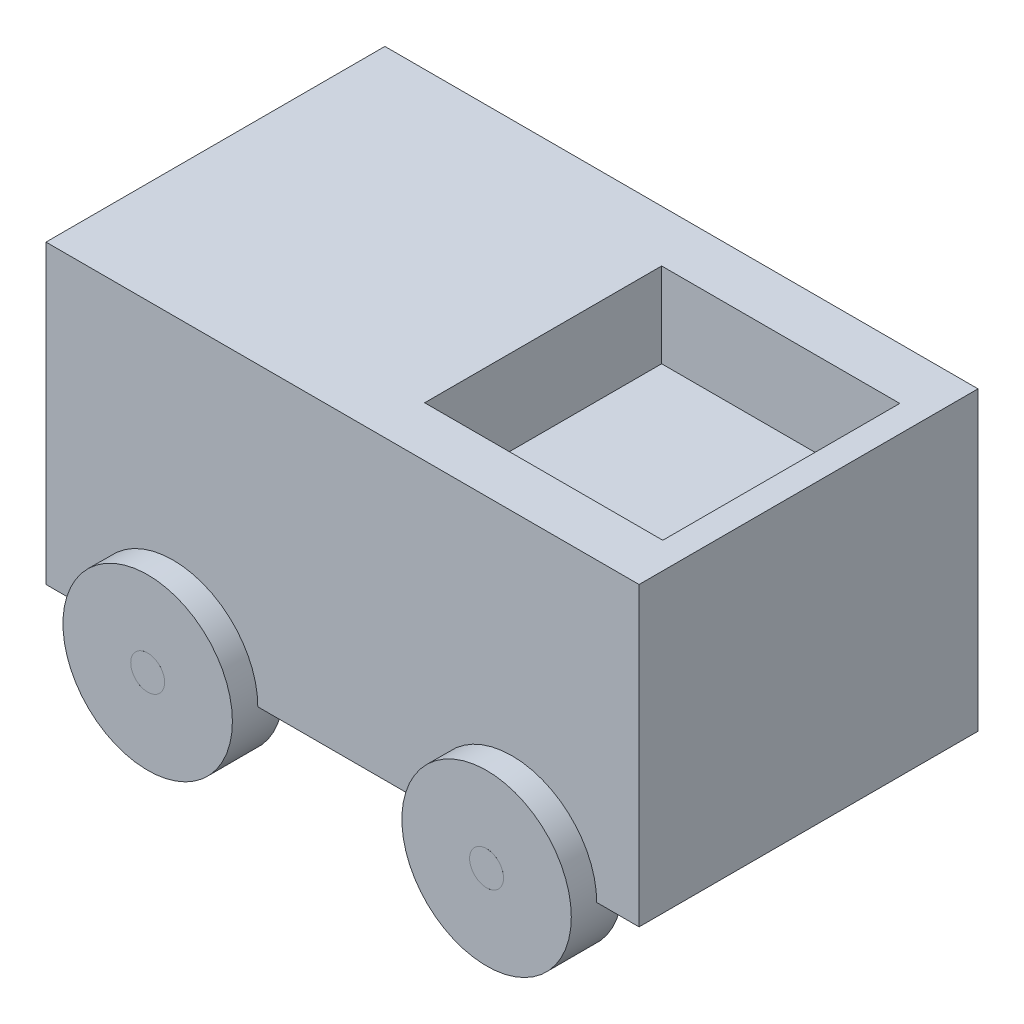
from build123d import *

# Parameters (mm, degrees)
SKETCH2_W                 = 70
SKETCH2_H                 = 35
BOSS_EXTRUDE2_DEPTH       = 40
SKETCH3_W                 = 28.105894453
SKETCH3_H                 = 27.971945797
CUT_EXTRUDE1_DEPTH        = 10
SKETCH4_R                 = 10
CUT_EXTRUDE2_DEPTH        = 3
CUT_EXTRUDE3_START        = -3
SKETCH5_R                 = 10
CUT_EXTRUDE3_DEPTH        = 3
BOSS_EXTRUDE3_DEPTH       = 3
BOSS_EXTRUDE3_DEPTH_BACK  = 3
SKETCH6_R                 = 10
SKETCH7_R                 = 10
BOSS_EXTRUDE5_DEPTH       = 6
SKETCH8_R                 = 2
CUT_EXTRUDE5_DEPTH        = 46
BOSS_EXTRUDE8_DEPTH       = 0.0001
BOSS_EXTRUDE8_DEPTH_BACK  = 46.0001
SKETCH9_R                 = 2
BOSS_EXTRUDE9_DEPTH       = 3
BOSS_EXTRUDE9_DEPTH_BACK  = 3
SKETCH10_R                = 10
BOSS_EXTRUDE10_DEPTH      = 3
BOSS_EXTRUDE10_DEPTH_BACK = 3
SKETCH11_R                = 10
SKETCH12_R                = 2
CUT_EXTRUDE6_DEPTH        = 46
BOSS_EXTRUDE11_DEPTH      = 0.001
BOSS_EXTRUDE11_DEPTH_BACK = 46.001
SKETCH13_R                = 2


with BuildPart() as part:
    # Sketch2 → Boss-Extrude2 (new body)
    with BuildSketch(Plane.XY):
        with Locations((-35, -17.5)):
            Rectangle(SKETCH2_W, SKETCH2_H)
    extrude(amount=BOSS_EXTRUDE2_DEPTH)

    # Sketch3 → Cut-Extrude1 (cut)
    with BuildSketch(Plane(origin=(0, 0, 0), x_dir=(1, 0, 0), z_dir=(0, 1, 0))):
        with Locations((-17.175677586, -20.094439992)):
            Rectangle(SKETCH3_W, SKETCH3_H)
    extrude(amount=-CUT_EXTRUDE1_DEPTH, mode=Mode.SUBTRACT)

    # Sketch4 → Cut-Extrude2 (cut)
    with BuildSketch(Plane.XY.offset(40)):
        with Locations((-15, -35)):
            Circle(SKETCH4_R)
        with Locations((-55, -35)):
            Circle(SKETCH4_R)
    extrude(amount=-CUT_EXTRUDE2_DEPTH, mode=Mode.SUBTRACT)

    # Sketch5 → Cut-Extrude3 (cut)
    with BuildSketch(Plane(origin=(0, 0, 0), x_dir=(-1, 0, 0), z_dir=(0, 0, -1)).offset(CUT_EXTRUDE3_START)):
        with Locations((15, -35)):
            Circle(SKETCH5_R)
        with Locations((55, -35)):
            Circle(SKETCH5_R)
    extrude(amount=CUT_EXTRUDE3_DEPTH, mode=Mode.SUBTRACT)

    # Sketch6 → Boss-Extrude3 (add, two sides: drawn at the far end of the back side and taken through both)
    with BuildSketch(Plane.XY.offset(40).offset(-BOSS_EXTRUDE3_DEPTH_BACK)):
        with Locations((-55, -35)):
            Circle(SKETCH6_R)
    extrude(amount=BOSS_EXTRUDE3_DEPTH + BOSS_EXTRUDE3_DEPTH_BACK)

    # Sketch7 → Boss-Extrude5 (add)
    with BuildSketch(Plane(origin=(0, 0, 3), x_dir=(-1, 0, 0), z_dir=(0, 0, -1))):
        with Locations((55, -35)):
            Circle(SKETCH7_R)
    extrude(amount=BOSS_EXTRUDE5_DEPTH)

    # Sketch8 → Cut-Extrude5 (cut)
    with BuildSketch(Plane(origin=(0, 0, -3), x_dir=(-1, 0, 0), z_dir=(0, 0, -1))):
        with Locations((55, -35)):
            Circle(SKETCH8_R)
    extrude(amount=-CUT_EXTRUDE5_DEPTH, mode=Mode.SUBTRACT)

    # Sketch9 → Boss-Extrude8 (add, two sides: drawn at the far end of the back side and taken through both)
    with BuildSketch(Plane(origin=(0, 0, -3), x_dir=(-1, 0, 0), z_dir=(0, 0, -1)).offset(-BOSS_EXTRUDE8_DEPTH_BACK)):
        with Locations((55, -35)):
            Circle(SKETCH9_R)
    extrude(amount=BOSS_EXTRUDE8_DEPTH + BOSS_EXTRUDE8_DEPTH_BACK)

    # Sketch10 → Boss-Extrude9 (add, two sides: drawn at the far end of the back side and taken through both)
    with BuildSketch(Plane.XY.offset(40).offset(-BOSS_EXTRUDE9_DEPTH_BACK)):
        with Locations((-15, -35)):
            Circle(SKETCH10_R)
    extrude(amount=BOSS_EXTRUDE9_DEPTH + BOSS_EXTRUDE9_DEPTH_BACK)

    # Sketch11 → Boss-Extrude10 (add, two sides: drawn at the far end of the back side and taken through both)
    with BuildSketch(Plane(origin=(0, 0, 0), x_dir=(-1, 0, 0), z_dir=(0, 0, -1)).offset(-BOSS_EXTRUDE10_DEPTH_BACK)):
        with Locations((15, -35)):
            Circle(SKETCH11_R)
    extrude(amount=BOSS_EXTRUDE10_DEPTH + BOSS_EXTRUDE10_DEPTH_BACK)

    # Sketch12 → Cut-Extrude6 (cut)
    with BuildSketch(Plane(origin=(0, 0, -3), x_dir=(-1, 0, 0), z_dir=(0, 0, -1))):
        with Locations((15, -35)):
            Circle(SKETCH12_R)
    extrude(amount=-CUT_EXTRUDE6_DEPTH, mode=Mode.SUBTRACT)

    # Sketch13 → Boss-Extrude11 (add, two sides: drawn at the far end of the back side and taken through both)
    with BuildSketch(Plane(origin=(0, 0, -3), x_dir=(-1, 0, 0), z_dir=(0, 0, -1)).offset(-BOSS_EXTRUDE11_DEPTH_BACK)):
        with Locations((15, -35)):
            Circle(SKETCH13_R)
    extrude(amount=BOSS_EXTRUDE11_DEPTH + BOSS_EXTRUDE11_DEPTH_BACK)


solid = part.part
